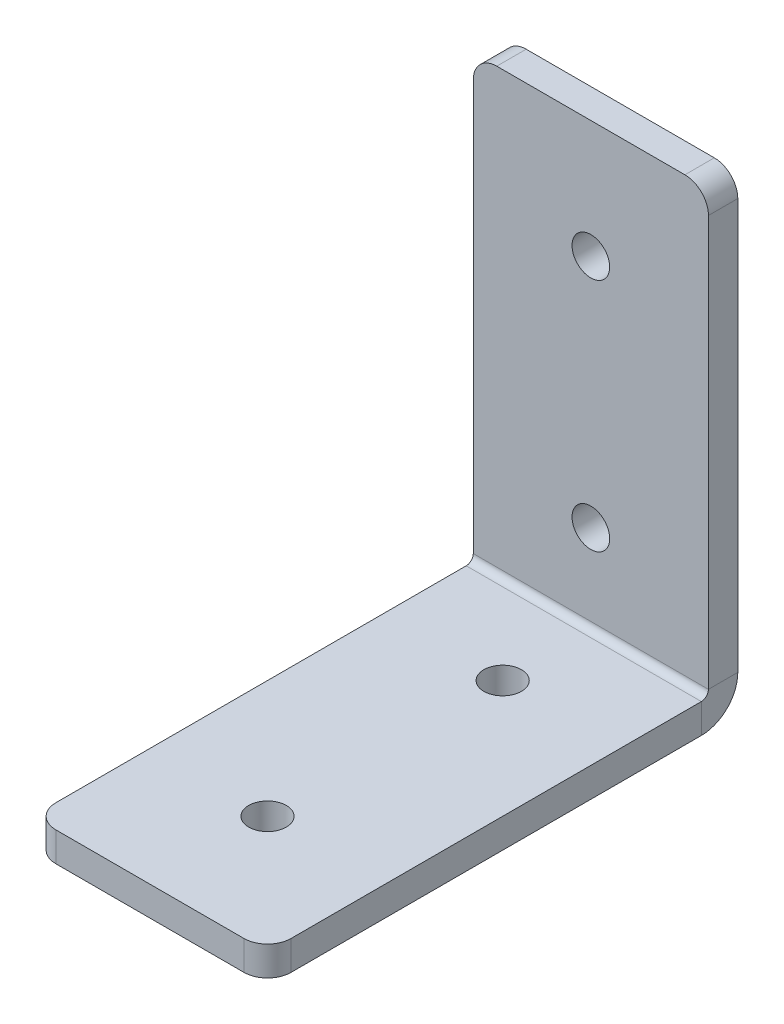
from build123d import *
from build123d.topology import SkipClean

# Parameters (mm, degrees)
SKETCH1_W                  = 25.4
SKETCH1_H                  = 50.8
SKETCH1_R                  = 2.032
BOSS_EXTRUDE1_DEPTH        = 1.27
SKETCH2_W                  = 25.4
SKETCH2_H                  = 50.8
SKETCH2_R                  = 2.032
BOSS_EXTRUDE2_DEPTH        = 1.27
CONVERT_SOLID2_START       = -24.13
CONVERT_SOLID2_OUTLINE_W   = 25.4
CONVERT_SOLID2_OUTLINE_H   = 49.53
CONVERT_SOLID2_OUTLINE_R   = 2.032
CONVERT_SOLID2_DEPTH       = 1.905
CONVERT_SOLID2_START_2     = -10.6679999
CONVERT_SOLID2_2_OUTLINE_W = 25.4
CONVERT_SOLID2_2_OUTLINE_H = 1.905
CONVERT_SOLID2_2_DEPTH     = 21.336301023
CONVERT_SOLID2_START_3     = 14.7320001
CONVERT_SOLID2_3_OUTLINE_W = 25.4
CONVERT_SOLID2_3_OUTLINE_H = 1.905
CONVERT_SOLID2_3_DEPTH     = 10.6679999
CONVERT_SOLID2_START_4     = -22.225
CONVERT_SOLID2_4_OUTLINE_W = 25.4
CONVERT_SOLID2_4_OUTLINE_H = 1.905
CONVERT_SOLID2_4_DEPTH     = 7.493301123
CONVERT_SOLID2_START_5     = 1.27
CONVERT_SOLID2_5_DEPTH     = 1.905
CONVERT_SOLID2_6_DEPTH     = 1.905
CONVERT_SOLID2_START_6     = -14
CONVERT_SOLID2_7_DEPTH     = 28
CONVERT_SOLID2_START_7     = -12.7
CONVERT_SOLID2_8_DEPTH     = 25.4
FILLET1_R                  = 2.54


with BuildPart() as part:
    # Sketch1 → Boss-Extrude1 (new body)
    with BuildSketch(Plane(origin=(0, 0, 0), x_dir=(1, 0, 0), z_dir=(0, 1, 0))):
        Rectangle(SKETCH1_W, SKETCH1_H)
        with Locations(Location((0, 12.7, 0), (0, 0, 270))):
            Circle(SKETCH1_R, mode=Mode.SUBTRACT)
        with Locations(Location((0, -12.7, 0), (0, 0, 90))):
            Circle(SKETCH1_R, mode=Mode.SUBTRACT)
    extrude(amount=BOSS_EXTRUDE1_DEPTH)

    # Sketch2 → Boss-Extrude2 (add)
    with BuildSketch(Plane(origin=(0, 0, -25.4), x_dir=(-1, 0, 0), z_dir=(0, 0, -1))):
        with Locations((0, 25.4)):
            Rectangle(SKETCH2_W, SKETCH2_H)
        with Locations((0, 12.7)):
            Circle(SKETCH2_R, mode=Mode.SUBTRACT)
        with Locations(Location((0, 38.1, 0), (0, 0, 180))):
            Circle(SKETCH2_R, mode=Mode.SUBTRACT)
    extrude(amount=-BOSS_EXTRUDE2_DEPTH)

    # Convert-Solid2: read off the stored shape, not the designer's step
    # Convert-Solid2 outline → Convert-Solid2 (add)
    with SkipClean():  # the faces are left unmerged after this step: merging them gives an invalid solid
        with BuildSketch(Plane.XY.offset(CONVERT_SOLID2_START)):
            with Locations((0, 26.035)):
                Rectangle(CONVERT_SOLID2_OUTLINE_W, CONVERT_SOLID2_OUTLINE_H)
            with Locations((0, 12.7)):
                Circle(CONVERT_SOLID2_OUTLINE_R, mode=Mode.SUBTRACT)
            with Locations((0, 38.1)):
                Circle(CONVERT_SOLID2_OUTLINE_R, mode=Mode.SUBTRACT)
        extrude(amount=CONVERT_SOLID2_DEPTH)
    add(part.part.scale(1), mode=Mode.REPLACE)  # the faces are merged on a copy

    # Convert-Solid2 2 outline → Convert-Solid2 2 (add)
    with BuildSketch(Plane.XY.offset(CONVERT_SOLID2_START_2)):
        with Locations((0, 2.2225)):
            Rectangle(CONVERT_SOLID2_2_OUTLINE_W, CONVERT_SOLID2_2_OUTLINE_H)
    extrude(amount=CONVERT_SOLID2_2_DEPTH)

    # Convert-Solid2 3 outline → Convert-Solid2 3 (add)
    with BuildSketch(Plane.XY.offset(CONVERT_SOLID2_START_3)):
        with Locations((0, 2.2225)):
            Rectangle(CONVERT_SOLID2_3_OUTLINE_W, CONVERT_SOLID2_3_OUTLINE_H)
    extrude(amount=CONVERT_SOLID2_3_DEPTH)

    # Convert-Solid2 4 outline → Convert-Solid2 4 (add)
    with BuildSketch(Plane.XY.offset(CONVERT_SOLID2_START_4)):
        with Locations((0, 2.2225)):
            Rectangle(CONVERT_SOLID2_4_OUTLINE_W, CONVERT_SOLID2_4_OUTLINE_H)
    extrude(amount=CONVERT_SOLID2_4_DEPTH)

    # Convert-Solid2 5 outline → Convert-Solid2 5 (cut)
    with BuildSketch(Plane(origin=(0, 0, 0), x_dir=(1, 0, 0), z_dir=(0, 1, 0)).offset(CONVERT_SOLID2_START_5)):
        with BuildLine():
            ThreePointArc((0.034981041, -10.668301123), (0, -10.668), (-0.034981041, -10.668301123))
            Line((-0.034981041, -10.668301123), (0.034981041, -10.668301123))
        make_face()
        with BuildLine():
            ThreePointArc((0.034981041, 14.731698877), (0, 14.732), (-0.034981041, 14.731698877))
            Line((-0.034981041, 14.731698877), (0.034981041, 14.731698877))
        make_face()
    extrude(amount=CONVERT_SOLID2_5_DEPTH, mode=Mode.SUBTRACT)

    # Convert-Solid2 6 outline → Convert-Solid2 6 (add)
    with BuildSketch(Plane(origin=(0, 0, 0), x_dir=(1, 0, 0), z_dir=(0, 1, 0)).offset(CONVERT_SOLID2_START_5)):
        with BuildLine():
            Line((-12.7, -10.668301123), (-12.7, -14.7320001))
            Line((-12.7, -14.7320001), (0, -14.732))
            ThreePointArc((0, -14.732), (-2.031924718, -12.717491168), (-0.034981041, -10.668301123))
            Line((-0.034981041, -10.668301123), (-12.7, -10.668301123))
        make_face()
        with BuildLine():
            ThreePointArc((0.034981041, -10.668301123), (2.031924718, -12.717491168), (0, -14.732))
            Line((0, -14.732), (12.7, -14.7320001))
            Line((12.7, -14.7320001), (12.7, -10.668301123))
            Line((12.7, -10.668301123), (0.034981041, -10.668301123))
        make_face()
        with BuildLine():
            Line((-12.7, 14.731698877), (-12.7, 10.6679999))
            Line((-12.7, 10.6679999), (0, 10.668))
            ThreePointArc((0, 10.668), (-2.031924718, 12.682508832), (-0.034981041, 14.731698877))
            Line((-0.034981041, 14.731698877), (-12.7, 14.731698877))
        make_face()
        with BuildLine():
            ThreePointArc((0.034981041, 14.731698877), (2.031924718, 12.682508832), (0, 10.668))
            Line((0, 10.668), (12.7, 10.6679999))
            Line((12.7, 10.6679999), (12.7, 14.731698877))
            Line((12.7, 14.731698877), (0.034981041, 14.731698877))
        make_face()
    extrude(amount=CONVERT_SOLID2_6_DEPTH)

    # Convert-Solid2 7 outline → Convert-Solid2 7 (cut)
    with SkipClean():  # the faces are left unmerged after this step: merging them gives an invalid solid
        with BuildSketch(Plane.YZ.offset(CONVERT_SOLID2_START_6)):
            with BuildLine():
                ThreePointArc((3.937, -25.4), (1.153120602, -24.246879398), (0, -21.463))
                Line((0, -21.463), (0, -25.4))
                Line((0, -25.4), (3.937, -25.4))
            make_face()
        extrude(amount=CONVERT_SOLID2_7_DEPTH, mode=Mode.SUBTRACT)

    # Convert-Solid2 8 outline → Convert-Solid2 8 (add)
    with SkipClean():  # the faces are left unmerged after this step: merging them gives an invalid solid
        with BuildSketch(Plane.YZ.offset(CONVERT_SOLID2_START_7)):
            with BuildLine():
                ThreePointArc((3.937, -22.225), (3.398184633, -22.001815367), (3.175, -21.463))
                Line((3.175, -21.463), (3.175, -22.225))
                Line((3.175, -22.225), (3.937, -22.225))
            make_face()
        extrude(amount=CONVERT_SOLID2_8_DEPTH)

    # Fillet1
    fillet1_edges = [part.edges().sort_by_distance(p)[0] for p in [
        (-12.7, 1.5875, 25.4),
        (12.7, 1.5875, 25.4),
        (12.7, 50.8, -23.8125),
        (-12.7, 50.8, -23.8125),
    ]]
    fillet(fillet1_edges, radius=FILLET1_R)


solid = part.part
